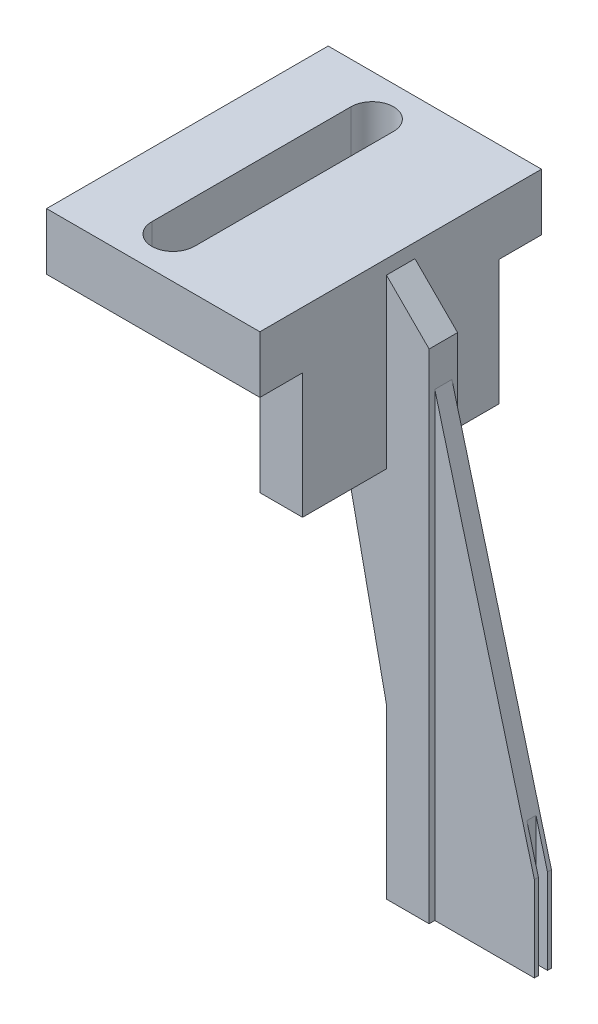
from build123d import *

# Parameters (mm, degrees)
SKETCH1_W               = 13.8
SKETCH1_H               = 8.8
BOSS_EXTRUDE1_DEPTH     = 3
SKETCH2_W               = 2
SKETCH2_H               = 35
BOSS_EXTRUDE2_DEPTH     = 3
SKETCH3_W               = 1.2
SKETCH3_H               = 6
BOSS_EXTRUDE3_DEPTH     = 7
FILLET3_R               = 10
SKETCH5_W               = 15
SKETCH5_H               = 13.8
BOSS_EXTRUDE4_DEPTH     = 4
SKETCH6_R               = 1.5
CUT_EXTRUDE4_DEPTH      = 38.968539608
BOSS_EXTRUDE5_DEPTH     = 2
CHAMFER2_SIZE           = 3
BOSS_EXTRUDE7_DEPTH     = 1.2
SKETCH12_W              = 15
SKETCH12_H              = 4
BOSS_EXTRUDE8_DEPTH     = 3
SKETCH13_W              = 15
SKETCH13_H              = 4
BOSS_EXTRUDE9_DEPTH     = 3
CUT_EXTRUDE7_DEPTH      = 43.28486727
CUT_EXTRUDE7_DEPTH_BACK = 43.28486727
CUT_EXTRUDE8_DEPTH      = 43.28486727
CUT_EXTRUDE8_DEPTH_BACK = 43.28486727
SKETCH15_W              = 0.807911756
SKETCH15_H              = 0.64
CUT_EXTRUDE9_DEPTH      = 41.244591358
CUT_EXTRUDE9_DEPTH_BACK = 41.244591358
SKETCH16_W              = 0.64
SKETCH16_H              = 0.6
CHAMFER3_SIZE           = 1


# Some blends are built 0.0001 mm under size
with BuildPart() as part:
    # Sketch1 → Boss-Extrude1 (new body)
    with BuildSketch(Plane(origin=(0, 0, 0), x_dir=(0, 0, -1), z_dir=(1, 0, 0))):
        Rectangle(SKETCH1_W, SKETCH1_H)
    extrude(amount=BOSS_EXTRUDE1_DEPTH)

    # Sketch2 → Boss-Extrude2 (add)
    with BuildSketch(Plane(origin=(3, 0, 0), x_dir=(0, 0, -1), z_dir=(1, 0, 0))):
        with Locations((0, -13.1)):
            Rectangle(SKETCH2_W, SKETCH2_H)
    extrude(amount=BOSS_EXTRUDE2_DEPTH)

    # Sketch3 → Boss-Extrude3 (add)
    with BuildSketch(Plane(origin=(6, 0, 0), x_dir=(0, 0, -1), z_dir=(1, 0, 0))):
        with Locations((0, -27.6)):
            Rectangle(SKETCH3_W, SKETCH3_H)
    extrude(amount=BOSS_EXTRUDE3_DEPTH)

    # Fillet3
    # the kernel refuses this fillet: 10 mm, written as the material it adds along each edge
    with BuildSketch(Plane(origin=(3, -4.4, 1), x_dir=(-1, 0, 0), z_dir=(0, 0, -1))) as fillet3_piece_1:
        with BuildLine():
            CenterArc((10, -7.141428429), FILLET3_R, 134.427004001, 45.572995999)
            Line((0, -7.141428429), (0, 0))
            Line((0, 0), (3, 0))
        make_face()
    extrude(amount=2)

    # Sketch5 → Boss-Extrude4 (add)
    with BuildSketch(Plane(origin=(0, 4.4, 0), x_dir=(1, 0, 0), z_dir=(0, 1, 0))):
        with Locations((-4.5, 0)):
            Rectangle(SKETCH5_W, SKETCH5_H)
    extrude(amount=BOSS_EXTRUDE4_DEPTH)

    # Sketch6 → Cut-Extrude4 (cut, through all)
    with BuildSketch(Plane.XZ.offset(-4.4)):
        with Locations(Location((-6, 3, 0), (0, 0, 270))):
            Circle(SKETCH6_R)
        with Locations(Location((-6, -3, 0), (0, 0, 270))):
            Circle(SKETCH6_R)
    extrude(amount=-CUT_EXTRUDE4_DEPTH, mode=Mode.SUBTRACT)

    # Sketch8 → Boss-Extrude5 (add)
    with BuildSketch(Plane(origin=(0, 0, -1), x_dir=(-1, 0, 0), z_dir=(0, 0, -1))):
        Polygon((-3, -18.758153574), (0, -4.4), (-3, -4.4), align=None)
    extrude(amount=-BOSS_EXTRUDE5_DEPTH)

    # Chamfer2
    chamfer2_edges = [part.edges().sort_by_distance(p)[0] for p in [
        (3, 4.4, 0),
    ]]
    chamfer(chamfer2_edges, length=CHAMFER2_SIZE - 0.0001)  # a hair under: the kernel refuses the full size

    # Sketch11 → Boss-Extrude7 (add)
    with BuildSketch(Plane(origin=(0, 0, -0.6), x_dir=(-1, 0, 0), z_dir=(0, 0, -1))):
        Polygon((-6, -24.6), (-13, -24.6), (-6, 1.742521041), align=None)
    extrude(amount=-BOSS_EXTRUDE7_DEPTH)

    # Sketch12 → Boss-Extrude8 (add)
    with BuildSketch(Plane(origin=(0, 0, -6.9), x_dir=(-1, 0, 0), z_dir=(0, 0, -1))):
        with Locations((4.5, 6.4)):
            Rectangle(SKETCH12_W, SKETCH12_H)
    extrude(amount=BOSS_EXTRUDE8_DEPTH)

    # Sketch13 → Boss-Extrude9 (add)
    with BuildSketch(Plane.XY.offset(6.9)):
        with Locations((-4.5, 6.4)):
            Rectangle(SKETCH13_W, SKETCH13_H)
    extrude(amount=BOSS_EXTRUDE9_DEPTH)

    # Sketch14 → Cut-Extrude7 (cut, two sides: drawn at the far end of the back side and taken through both)
    with BuildSketch(Plane(origin=(0, 8.4, 0), x_dir=(1, 0, 0), z_dir=(0, 1, 0)).offset(-CUT_EXTRUDE7_DEPTH_BACK)):
        with BuildLine():
            Line((-7.5, 7), (-7.5, -7))
            ThreePointArc((-7.5, -7), (-6, -8.5), (-4.5, -7))
            Line((-4.5, -7), (-4.5, 7))
            ThreePointArc((-4.5, 7), (-6, 8.5), (-7.5, 7))
        make_face()
    extrude(amount=CUT_EXTRUDE7_DEPTH + CUT_EXTRUDE7_DEPTH_BACK, mode=Mode.SUBTRACT)

    # Sketch15 → Cut-Extrude8 (cut, two sides: drawn at the far end of the back side and taken through both)
    with BuildSketch(Plane.XZ.offset(30.6).offset(-CUT_EXTRUDE8_DEPTH_BACK)):
        with Locations((12.596044122, 0)):
            Rectangle(SKETCH15_W, SKETCH15_H)
    extrude(amount=CUT_EXTRUDE8_DEPTH + CUT_EXTRUDE8_DEPTH_BACK, mode=Mode.SUBTRACT)

    # Sketch16 → Cut-Extrude9 (cut, two sides: drawn at the far end of the back side and taken through both)
    with BuildSketch(Plane(origin=(12.192088244, 0, 0), x_dir=(0, 0, -1), z_dir=(1, 0, 0)).offset(-CUT_EXTRUDE9_DEPTH_BACK)):
        with Locations((0, -30.3)):
            Rectangle(SKETCH16_W, SKETCH16_H)
    extrude(amount=CUT_EXTRUDE9_DEPTH + CUT_EXTRUDE9_DEPTH_BACK, mode=Mode.SUBTRACT)

    # Chamfer3
    chamfer3_edges = [part.edges().sort_by_distance(p)[0] for p in [
        (12.192088244, -30, 0),
    ]]
    chamfer(chamfer3_edges, length=CHAMFER3_SIZE)


solid = part.part
